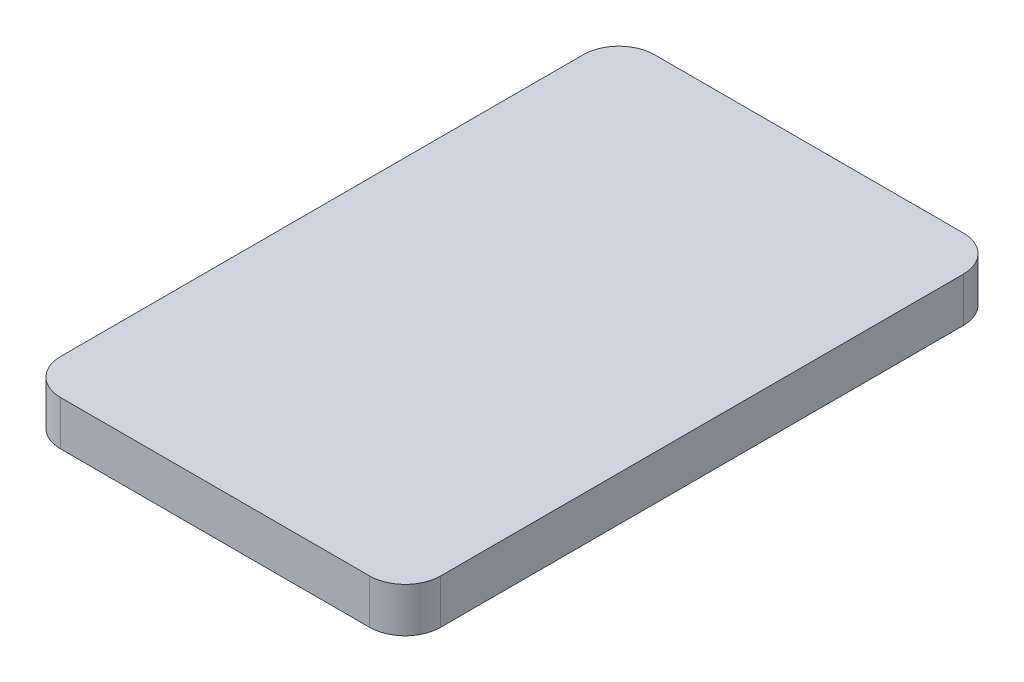
from build123d import *

# Parameters (mm, degrees)
SKETCH1_W           = 32
SKETCH1_H           = 50
BOSS_EXTRUDE1_DEPTH = 3.75
FILLET1_R           = 3


with BuildPart() as part:
    # Sketch1 → Boss-Extrude1 (new body)
    with BuildSketch(Plane(origin=(0, 0, 0), x_dir=(1, 0, 0), z_dir=(0, 1, 0))):
        with Locations((16, 25)):
            Rectangle(SKETCH1_W, SKETCH1_H)
    extrude(amount=BOSS_EXTRUDE1_DEPTH)

    # Fillet1
    fillet1_edges = [part.edges().sort_by_distance(p)[0] for p in [
        (0, 1.875, -50),
        (32, 1.875, -50),
        (0, 1.875, 0),
        (32, 1.875, 0),
    ]]
    fillet(fillet1_edges, radius=FILLET1_R)


solid = part.part
